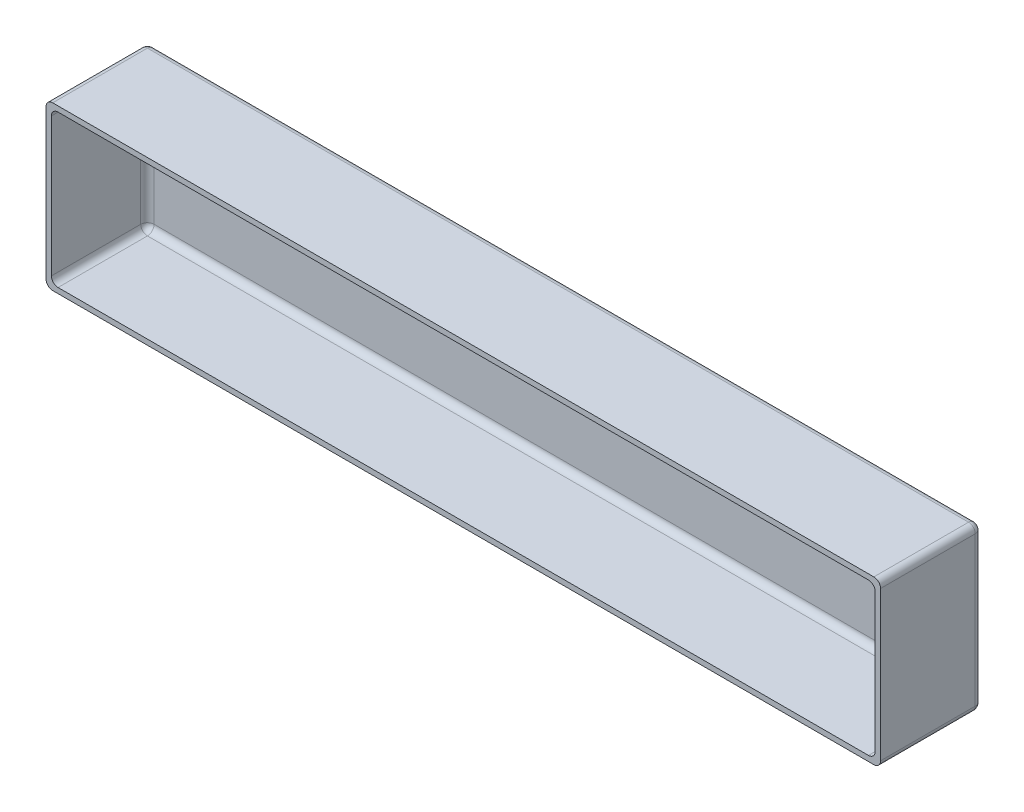
from build123d import *

# Parameters (mm, degrees)
SKETCH1_W           = 237.236
SKETCH1_H           = 46.228
BOSS_EXTRUDE1_DEPTH = 28.829
SHELL1_T            = -1.524
FILLET1_R           = 1.905
FILLET2_R           = 1.905


with BuildPart() as part:
    # Sketch1 → Boss-Extrude1 (new body)
    with BuildSketch(Plane.XY):
        Rectangle(SKETCH1_W, SKETCH1_H)
    extrude(amount=BOSS_EXTRUDE1_DEPTH)

    # Shell1
    shell1_openings = [part.faces().sort_by_distance(p)[0] for p in [
        (0, 0, 28.829),
    ]]
    offset(amount=SHELL1_T, openings=shell1_openings, kind=Kind.INTERSECTION)

    # Fillet1
    fillet1_edges = [part.edges().sort_by_distance(p)[0] for p in [
        (0, -21.59, 1.524),
        (-117.094, 0, 1.524),
        (0, 21.59, 1.524),
        (117.094, 0, 1.524),
        (117.094, -21.59, 15.1765),
        (117.094, 21.59, 15.1765),
        (-117.094, -21.59, 15.1765),
        (-117.094, 21.59, 15.1765),
    ]]
    fillet(fillet1_edges, radius=FILLET1_R)

    # Fillet2
    fillet2_edges = [part.edges().sort_by_distance(p)[0] for p in [
        (118.618, 0, 0),
        (-118.618, 0, 0),
        (0, 23.114, 0),
        (-118.618, 23.114, 14.4145),
        (-118.618, -23.114, 14.4145),
        (0, -23.114, 0),
        (118.618, -23.114, 14.4145),
        (118.618, 23.114, 14.4145),
    ]]
    fillet(fillet2_edges, radius=FILLET2_R)


solid = part.part
